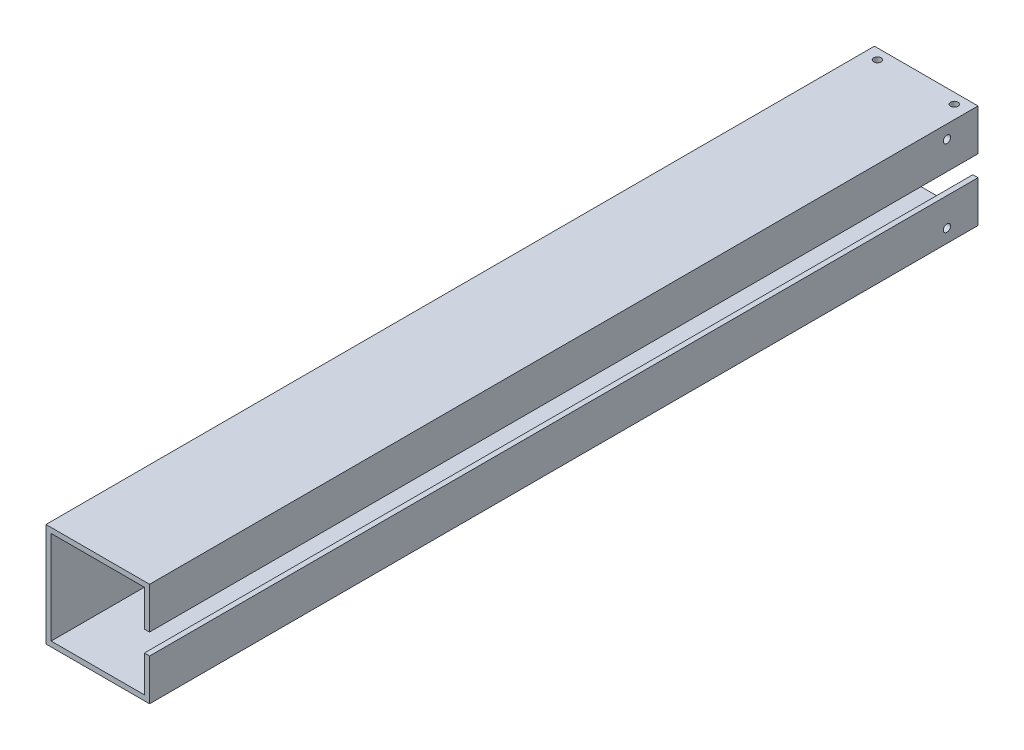
from build123d import *

# Parameters (mm, degrees)
BOSS_EXTRUDE1_DEPTH     = 508
CUT_EXTRUDE1_DEPTH      = 254
CUT_EXTRUDE1_DEPTH_BACK = 254
SKETCH2_R               = 2.25
SKETCH4_R               = 2.25
CUT_EXTRUDE2_DEPTH      = 254


with BuildPart() as part:
    # Sketch1 → Boss-Extrude1 (new body)
    with BuildSketch(Plane(origin=(0, 0, 0), x_dir=(0, 1, 0), z_dir=(0, 0, 1))):
        Polygon((28.575, 28.575), (28.575, -28.575), (6.35, -28.575), (6.35, -31.75), (31.75, -31.75), (31.75, 31.75), (-31.75, 31.75), (-31.75, -31.75), (-6.35, -31.75), (-6.35, -28.575), (-28.575, -28.575), (-28.575, 28.575), align=None)
    extrude(amount=BOSS_EXTRUDE1_DEPTH)

    # Sketch2 → Cut-Extrude1 (cut, two sides: drawn at the far end of the back side and taken through both)
    with BuildSketch(Plane(origin=(0, 0, 0), x_dir=(-1, 0, 0), z_dir=(0, 1, 0)).offset(-CUT_EXTRUDE1_DEPTH_BACK)):
        with Locations((-23.575, 6.35)):
            Circle(SKETCH2_R)
        with Locations((23.575, 6.35)):
            Circle(SKETCH2_R)
    extrude(amount=CUT_EXTRUDE1_DEPTH + CUT_EXTRUDE1_DEPTH_BACK, mode=Mode.SUBTRACT)

    # Sketch4 → Cut-Extrude2 (cut)
    with BuildSketch(Plane.YZ.offset(31.75)):
        with Locations((-23.575, 19.05)):
            Circle(SKETCH4_R)
        with Locations((23.575, 19.05)):
            Circle(SKETCH4_R)
    extrude(amount=-CUT_EXTRUDE2_DEPTH, mode=Mode.SUBTRACT)


solid = part.part
